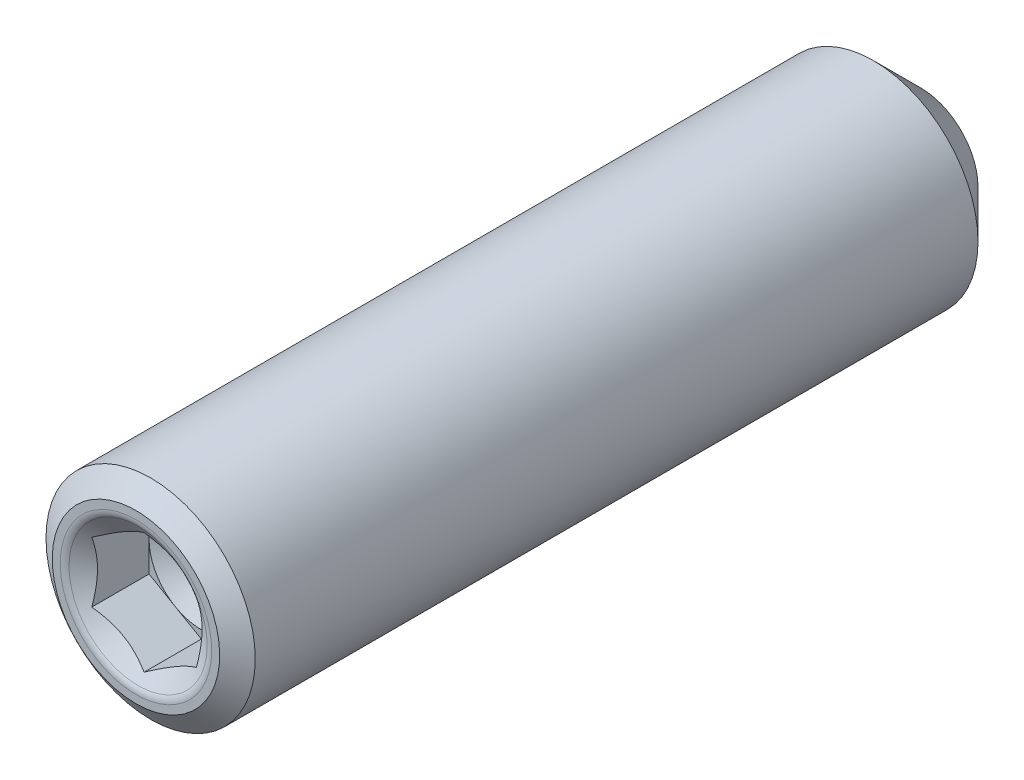
from build123d import *

# Parameters (mm, degrees)
CUT_EXTRUDE10_DEPTH = 2.5
FILLET2_R           = 0.445299462


with BuildPart() as part:
    # Sketch22 → Revolve1 (revolve)
    with BuildSketch(Plane(origin=(0, 0, 0), x_dir=(0, 0, -1), z_dir=(1, 0, 0))):
        Polygon((-14.341498934, 0), (-14.341498934, 3.2), (-13.781332904, 4), (13.850360691, 4), (15.658501066, 2.191859625), (14.341498934, 0), align=None)
    revolve(axis=Axis((0, 0, -14.341498934), (0, 0, -1)))

    # Sketch23 → Cut-Extrude10 (cut)
    with BuildSketch(Plane.XY.offset(14.341498934)):
        Polygon((0, 2.309401077), (-2, 1.154700538), (-2, -1.154700538), (0, -2.309401077), (2, -1.154700538), (2, 1.154700538), align=None)
    extrude(amount=-CUT_EXTRUDE10_DEPTH, mode=Mode.SUBTRACT)

    # Cut-Extrude11 cone 1 section (through the dimple's axis) → Cut-Extrude11 (revolve, cut)
    with BuildSketch(Plane(origin=(0, 0, 14.341498934), x_dir=(0, -1, 0), z_dir=(1, 0, 0))):
        Polygon((0, 0), (2.754700538, 0), (0, 1.928862082), align=None)
    revolve(axis=Axis((0, 0, 14.341498934), (0, 0, -1)), mode=Mode.SUBTRACT)

    # Cut-Extrude12 cone 1 section (through the dimple's axis) → Cut-Extrude12 (revolve, cut)
    with BuildSketch(Plane(origin=(0, 0, 11.841498934), x_dir=(0, -1, 0), z_dir=(1, 0, 0))):
        Polygon((0, 0), (2, 0), (0, 1.154700538), align=None)
    revolve(axis=Axis((0, 0, 11.841498934), (0, 0, -1)), mode=Mode.SUBTRACT)

    # Fillet2
    fillet2_edges = [part.edges().sort_by_distance(p)[0] for p in [
        (0, 2.754700538, 14.341498934),
    ]]
    fillet(fillet2_edges, radius=FILLET2_R)


solid = part.part
